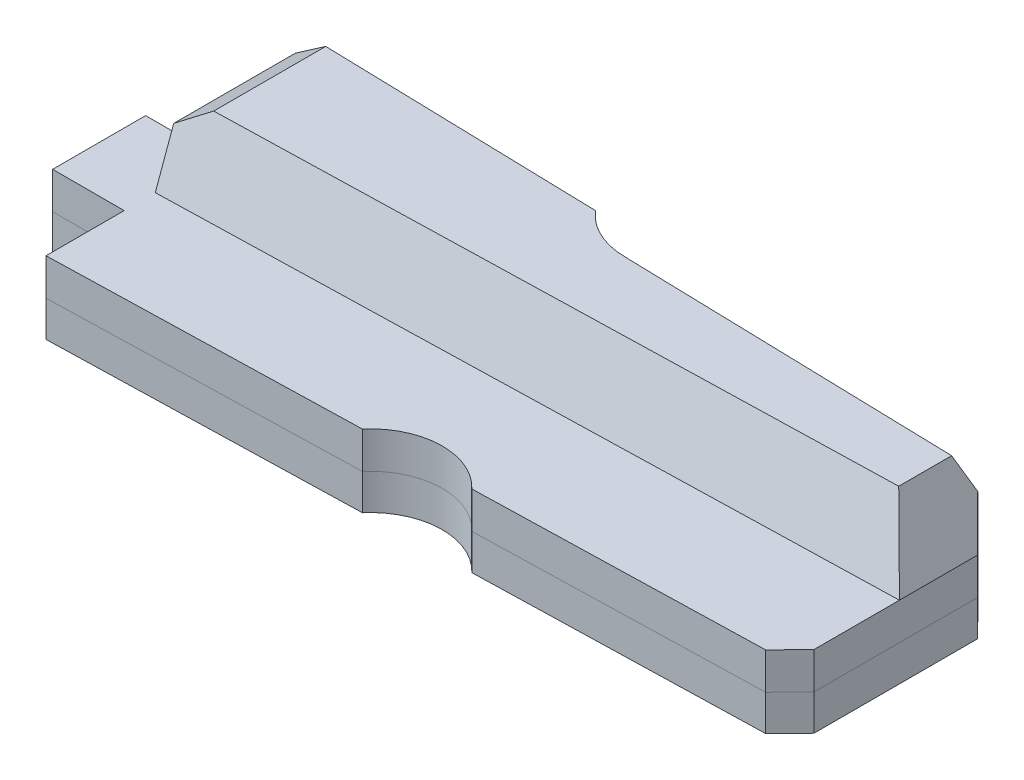
from build123d import *

# Parameters (mm, degrees)
BOSS_EXTRUDE1_DEPTH    = 6.08
BOSS_EXTRUDE2_DEPTH    = 6.09
SKETCH4_W              = 70.899698082
SKETCH4_H              = 9.313865989
CUT_EXTRUDE4_DEPTH     = 13.09
SKETCH5_W              = 29.305939782
SKETCH5_H              = 12.234342693
CUT_EXTRUDE5_DEPTH     = 19.09
SKETCH6_R              = 6
CUT_EXTRUDE6_DEPTH     = 60.839839878
CUT_EXTRUDE7_DEPTH     = 11.09
SKETCH10_W             = 36.097359295
SKETCH10_H             = 22.987225517
CUT_EXTRUDE11_DEPTH    = 63.929843377
SKETCH12_W             = 7.8
SKETCH12_H             = 6.08
BOSS_EXTRUDE4_DEPTH    = 6
CUT_EXTRUDE12_REACH    = 66.913
SKETCH13_W             = 18.746233403
SKETCH13_H             = 9.142839949
SPLIT1_SURFACE_1_BACK  = 72.047
SPLIT1_SURFACE_1_DEPTH = 144.094
SPLIT1_SURFACE_2_BACK  = 72.047
SPLIT1_SURFACE_2_DEPTH = 144.094


with BuildPart() as part:
    # Sketch1 → Boss-Extrude1 (new body)
    with BuildSketch(Plane(origin=(0, 0, 0), x_dir=(1, 0, 0), z_dir=(0, 1, 0))):
        Polygon((-14.914047624, 10.796093069), (-14.914047624, -10.733906931), (57.585952376, -8.821379846), (57.585952376, 8.878620154), align=None)
    extrude(amount=BOSS_EXTRUDE1_DEPTH)

    # Sketch2 → Boss-Extrude2 (add)
    with BuildSketch(Plane(origin=(0, 6.08, 0), x_dir=(1, 0, 0), z_dir=(0, 1, 0))):
        Polygon((-13.064047624, 10.74716445), (-13.064047624, -1.521917904), (57.585952376, 0.341806766), (57.585952376, 8.878620154), align=None)
    extrude(amount=BOSS_EXTRUDE2_DEPTH)

    # Sketch4 → Cut-Extrude4 (cut)
    with BuildSketch(Plane(origin=(0.078934537, 1.089467811, 2.992247256), x_dir=(0.9996522376299903, 0, -0.026370510070028146), z_dir=(0.02478017371916596, 0.34202014332566605, 0.9393658310530242))):
        with Locations((22.35021085, 9.967746424)):
            Rectangle(SKETCH4_W, SKETCH4_H)
    extrude(amount=CUT_EXTRUDE4_DEPTH, mode=Mode.SUBTRACT)

    # Sketch5 → Cut-Extrude5 (cut)
    with BuildSketch(Plane(origin=(52.803749931, 19.218993233, 0), x_dir=(0, 0, -1), z_dir=(0.9396926207859081, 0.34202014332566943, 1.2295842975475839e-15))):
        with Locations((0.411188199, -7.865053205)):
            Rectangle(SKETCH5_W, SKETCH5_H)
    extrude(amount=CUT_EXTRUDE5_DEPTH, mode=Mode.SUBTRACT)

    # Sketch6 → Cut-Extrude6 (cut, through all)
    with BuildSketch(Plane.XZ):
        with Locations((27.215952376, 13.62392238)):
            Circle(SKETCH6_R)
        with Locations((27.215952376, -13.683241685)):
            Circle(SKETCH6_R)
        Polygon((-14.914047624, 10.733906931), (-14.914047624, 8.733906931), (-12.914047624, 10.681147563), align=None)
        Polygon((-14.914047624, -10.796093069), (-12.914047624, -10.743197265), (-14.914047624, -8.796093069), align=None)
        Polygon((55.586647901, 8.874120866), (57.585952376, 8.821379846), (57.585952376, 6.821379846), align=None)
        Polygon((57.585952376, -8.878620154), (57.585952376, -6.878620154), (55.585952376, -8.931515959), align=None)
    extrude(amount=-CUT_EXTRUDE6_DEPTH, mode=Mode.SUBTRACT)

    # Sketch7 → Cut-Extrude7 (cut)
    with BuildSketch(Plane(origin=(0.305261026, 5.260141687, -11.541974951), x_dir=(-0.9997105289622884, 0.009976365195544153, -0.021893615951381312), z_dir=(0.024059473814631405, 0.4145836859950284, -0.9096930850712998))):
        Polygon((-26.921663821, 7.88786599), (-26.921663821, 3.064364781), (-63.575410801, 3.466220434), (-63.575410801, 10.38968732), (-26.921663821, 9.987831666), align=None)
    extrude(amount=CUT_EXTRUDE7_DEPTH, mode=Mode.SUBTRACT)

    # Sketch10 → Cut-Extrude11 (cut, through all)
    with BuildSketch(Plane.ZY.offset(3.214047624)):
        with Locations((0.41938451, 3.731019242)):
            Rectangle(SKETCH10_W, SKETCH10_H)
    extrude(amount=CUT_EXTRUDE11_DEPTH, mode=Mode.SUBTRACT)

    # Sketch12 → Boss-Extrude4 (add)
    with BuildSketch(Plane.ZY.offset(3.214047624)):
        with Locations((-0.030693992, 3.04)):
            Rectangle(SKETCH12_W, SKETCH12_H)
    extrude(amount=BOSS_EXTRUDE4_DEPTH)

    # Sketch13 → Cut-Extrude12 (cut, up to next)
    with BuildSketch(Plane(origin=(-5.91505424, 8.447572923, 0), x_dir=(0, 0, 1), z_dir=(-0.5735764363510444, 0.819152044288993, 0)), mode=Mode.PRIVATE) as cut_extrude12_sk1:
        with Locations((-4.290942315, 4.9788615)):
            Rectangle(SKETCH13_W, SKETCH13_H)
    cut_extrude12_tool1 = extrude(cut_extrude12_sk1.sketch, amount=CUT_EXTRUDE12_REACH, mode=Mode.PRIVATE) & part.part
    add(cut_extrude12_tool1.solids().sort_by_distance((-1.83661, 11.303331, -4.290942))[0], mode=Mode.SUBTRACT)


with BuildPart() as body_2:
    # Split1: the piece behind the surface
    add(part.part)
    # Split1 surface: a surface, the sketch's curves swept straight by 144.094 mm
    with BuildLine(Plane(origin=(0, 0, 0), x_dir=(0, 0, -1), z_dir=(1, 0, 0)).offset(-SPLIT1_SURFACE_1_BACK), mode=Mode.PRIVATE) as split1_surface_1_path:
        Line((17.375033742, 3), (-19.458800119, 3))
    split1_surface_1 = Shell.extrude(split1_surface_1_path.wire(), (1 * SPLIT1_SURFACE_1_DEPTH, 0 * SPLIT1_SURFACE_1_DEPTH, 0 * SPLIT1_SURFACE_1_DEPTH))
    split(bisect_by=split1_surface_1, keep=Keep.BOTTOM)


with BuildPart() as part_1:
    add(part.part)

    # Split1: split by a surface, the side it looks to stays
    # Split1 surface: a surface, the sketch's curves swept straight by 144.094 mm
    with BuildLine(Plane(origin=(0, 0, 0), x_dir=(0, 0, -1), z_dir=(1, 0, 0)).offset(-SPLIT1_SURFACE_2_BACK), mode=Mode.PRIVATE) as split1_surface_2_path:
        Line((17.375033742, 3), (-19.458800119, 3))
    split1_surface_2 = Shell.extrude(split1_surface_2_path.wire(), (1 * SPLIT1_SURFACE_2_DEPTH, 0 * SPLIT1_SURFACE_2_DEPTH, 0 * SPLIT1_SURFACE_2_DEPTH))
    split(bisect_by=split1_surface_2, keep=Keep.TOP)


solid = Compound([body_2.part, part_1.part])
